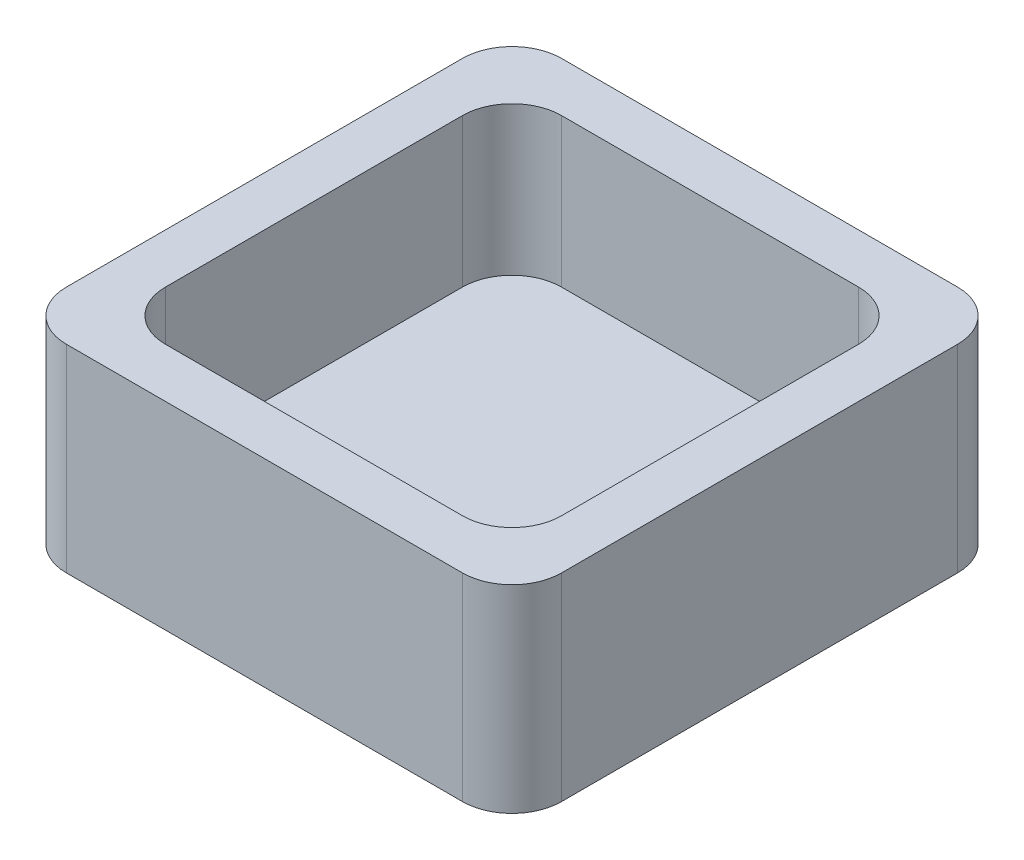
from build123d import *

# Parameters (mm, degrees)
SKETCH1_W           = 100
SKETCH1_H           = 100
BOSS_EXTRUDE1_DEPTH = 40
SKETCH2_W           = 80
SKETCH2_H           = 80
CUT_EXTRUDE1_DEPTH  = 30
SKETCH3_W           = 80
SKETCH3_H           = 80
BOSS_EXTRUDE2_DEPTH = 5
FILLET2_R           = 10
FILLET4_R           = 7
FILLET5_R           = 7


with BuildPart() as part:
    # Sketch1 → Boss-Extrude1 (new body)
    with BuildSketch(Plane(origin=(0, 0, 0), x_dir=(1, 0, 0), z_dir=(0, 1, 0))):
        Rectangle(SKETCH1_W, SKETCH1_H)
    extrude(amount=BOSS_EXTRUDE1_DEPTH)

    # Sketch2 → Cut-Extrude1 (cut)
    with BuildSketch(Plane(origin=(0, 40, 0), x_dir=(1, 0, 0), z_dir=(0, 1, 0))):
        Rectangle(SKETCH2_W, SKETCH2_H)
    extrude(amount=-CUT_EXTRUDE1_DEPTH, mode=Mode.SUBTRACT)

    # Sketch3 → Boss-Extrude2 (add)
    with BuildSketch(Plane.XZ):
        Rectangle(SKETCH3_W, SKETCH3_H)
    extrude(amount=BOSS_EXTRUDE2_DEPTH)

    # Fillet2
    fillet2_edges = [part.edges().sort_by_distance(p)[0] for p in [
        (-40, 25, 40),
        (-40, 25, -40),
        (40, 25, -40),
        (40, 25, 40),
        (-50, 20, -50),
        (50, 20, -50),
        (50, 20, 50),
        (-50, 20, 50),
    ]]
    fillet(fillet2_edges, radius=FILLET2_R)

    # Fillet4
    fillet4_edges = [part.edges().sort_by_distance(p)[0] for p in [
        (-40, -2.5, 40),
        (-40, -2.5, -40),
        (40, -2.5, -40),
        (40, -2.5, 40),
    ]]
    fillet(fillet4_edges, radius=FILLET4_R)

    # Fillet5
    # the kernel refuses this fillet: 7 mm, written as the material it adds along each edge
    with BuildSketch(Plane(origin=(-33, 0, 33), x_dir=(-1, 0, 0), z_dir=(0, 0, -1))) as fillet5_piece_1:
        with BuildLine():
            CenterArc((13.708203932, -7), FILLET5_R, 90, 73.398450401)
            Line((7, -5), (6.865835921, -4.96))
            ThreePointArc((6.865835921, -4.96), (6.86, -2.5), (6.86, 0))
            Line((6.86, 0), (7, 0.14))
            Line((7, 0.14), (13.708203932, 0.14))
            Line((13.708203932, 0.14), (13.708203932, 0))
        make_face()
    revolve(axis=Axis((-33, 0, 33), (0, 1, 0)), revolution_arc=90)
    with BuildSketch(Plane(origin=(33, 0, 40), x_dir=(0, 0, 1), z_dir=(-1, 0, 0)), Plane(origin=(40, 0, -33), x_dir=(1, 0, 0), z_dir=(0, 0, 1)), Plane(origin=(-33, 0, -40), x_dir=(0, 0, -1), z_dir=(1, 0, 0)), Plane(origin=(-40, 0, 33), x_dir=(-1, 0, 0), z_dir=(0, 0, -1))) as fillet5_piece_2:
        with BuildLine():
            CenterArc((6.708203932, -7), FILLET5_R, 90, 73.398450401)
            Line((0, -5), (-0.134164079, -4.96))
            ThreePointArc((-0.134164079, -4.96), (-0.14, -2.5), (-0.14, 0))
            Line((-0.14, 0), (0, 0.14))
            Line((0, 0.14), (6.708203932, 0.14))
            Line((6.708203932, 0.14), (6.708203932, 0))
        make_face()
    extrude(amount=66)
    with BuildSketch(Plane(origin=(33, 0, 33), x_dir=(1, 0, 0), z_dir=(0, 0, -1))) as fillet5_piece_3:
        with BuildLine():
            CenterArc((13.708203932, 7), FILLET5_R, 196.601549599, 73.398450401)
            Line((7, 5), (6.865835921, 4.96))
            ThreePointArc((6.865835921, 4.96), (6.86, 2.5), (6.86, 0))
            Line((6.86, 0), (7, -0.14))
            Line((7, -0.14), (13.708203932, -0.14))
            Line((13.708203932, -0.14), (13.708203932, 0))
        make_face()
    revolve(axis=Axis((33, 0, 33), (0, -1, 0)), revolution_arc=90)
    with BuildSketch(Plane(origin=(33, 0, -33), x_dir=(1, 0, 0), z_dir=(0, 0, 1))) as fillet5_piece_4:
        with BuildLine():
            CenterArc((13.708203932, -7), FILLET5_R, 90, 73.398450401)
            Line((7, -5), (6.865835921, -4.96))
            ThreePointArc((6.865835921, -4.96), (6.86, -2.5), (6.86, 0))
            Line((6.86, 0), (7, 0.14))
            Line((7, 0.14), (13.708203932, 0.14))
            Line((13.708203932, 0.14), (13.708203932, 0))
        make_face()
    revolve(axis=Axis((33, 0, -33), (0, 1, 0)), revolution_arc=90)
    with BuildSketch(Plane(origin=(-33, 0, -33), x_dir=(0, 0, -1), z_dir=(1, 0, 0))) as fillet5_piece_5:
        with BuildLine():
            CenterArc((13.708203932, -7), FILLET5_R, 90, 73.398450401)
            Line((7, -5), (6.865835921, -4.96))
            ThreePointArc((6.865835921, -4.96), (6.86, -2.5), (6.86, 0))
            Line((6.86, 0), (7, 0.14))
            Line((7, 0.14), (13.708203932, 0.14))
            Line((13.708203932, 0.14), (13.708203932, 0))
        make_face()
    revolve(axis=Axis((-33, 0, -33), (0, 1, 0)), revolution_arc=90)


solid = part.part
